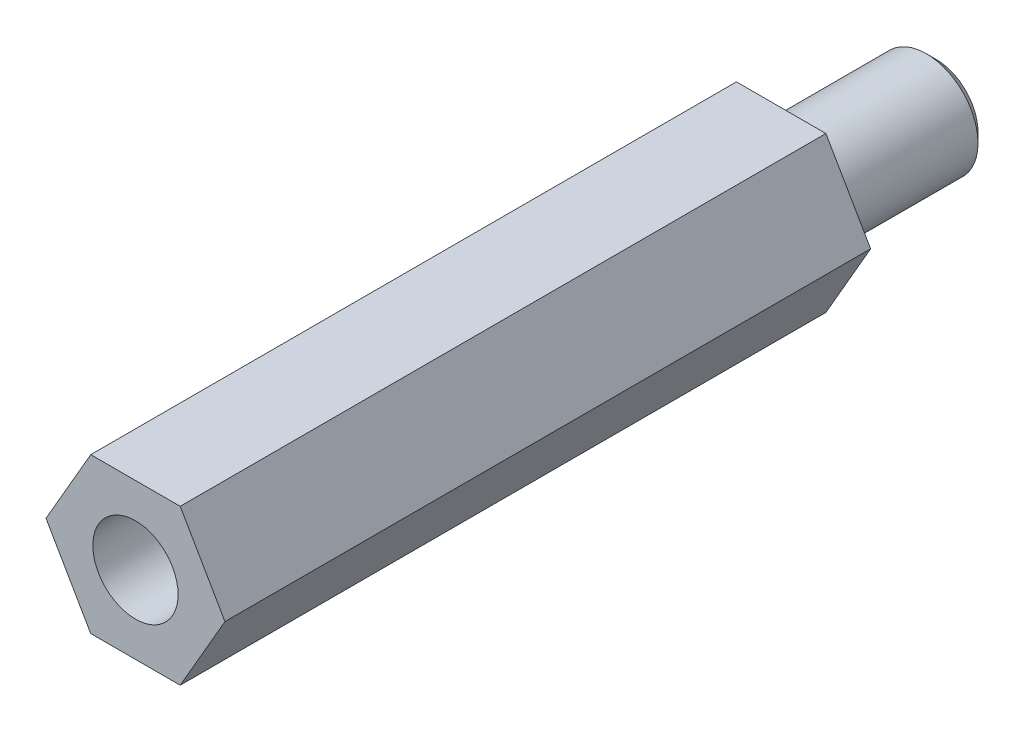
from build123d import *

# Parameters (mm, degrees)
EXTRUDE_1_DEPTH        = 25
HOLE_WIZARD_M4_1_D     = 3.3
HOLE_WIZARD_M4_1_DEPTH = 20
HOLE_WIZARD_M4_1_TIP   = 0.991420021
SKETCH_5_R             = 2
EXTRUDE_2_DEPTH        = 6


# Read off the part's stored shape, not the designer's step: M4 机械螺纹 螺柱1
with BuildPart() as part:
    # 草图1 → 凸台-拉伸1 (new body)
    with BuildSketch(Plane.XY):
        Polygon((-3.464101615, 0), (-1.732050808, -3), (1.732050808, -3), (3.464101615, 0), (1.732050808, 3), (-1.732050808, 3), align=None)
    extrude(amount=EXTRUDE_1_DEPTH)

    # M4 螺纹孔1
    with Locations(Plane.XY.offset(25)):
        with Locations((0, 0)):
            Hole(HOLE_WIZARD_M4_1_D / 2, depth=HOLE_WIZARD_M4_1_DEPTH)
            with Locations((0, 0, -(HOLE_WIZARD_M4_1_DEPTH + HOLE_WIZARD_M4_1_TIP / 2))):  # 118° drill point
                Cone(0, HOLE_WIZARD_M4_1_D / 2, HOLE_WIZARD_M4_1_TIP, mode=Mode.SUBTRACT)

    # 草图5 → 凸台-拉伸2 (add)
    with BuildSketch(Plane(origin=(0, 0, 0), x_dir=(-1, 0, 0), z_dir=(0, 0, -1))):
        Circle(SKETCH_5_R)
    extrude(amount=EXTRUDE_2_DEPTH)

    # M4 机械螺纹 螺柱1 outline → M4 机械螺纹 螺柱1 (revolve, cut)
    with BuildSketch(Plane.XZ):
        Polygon((2, -5.621), (1.621, -6), (2, -6), align=None)
    revolve(axis=Axis((0, 0, 0), (0, 0, 1)), mode=Mode.SUBTRACT)


solid = part.part
